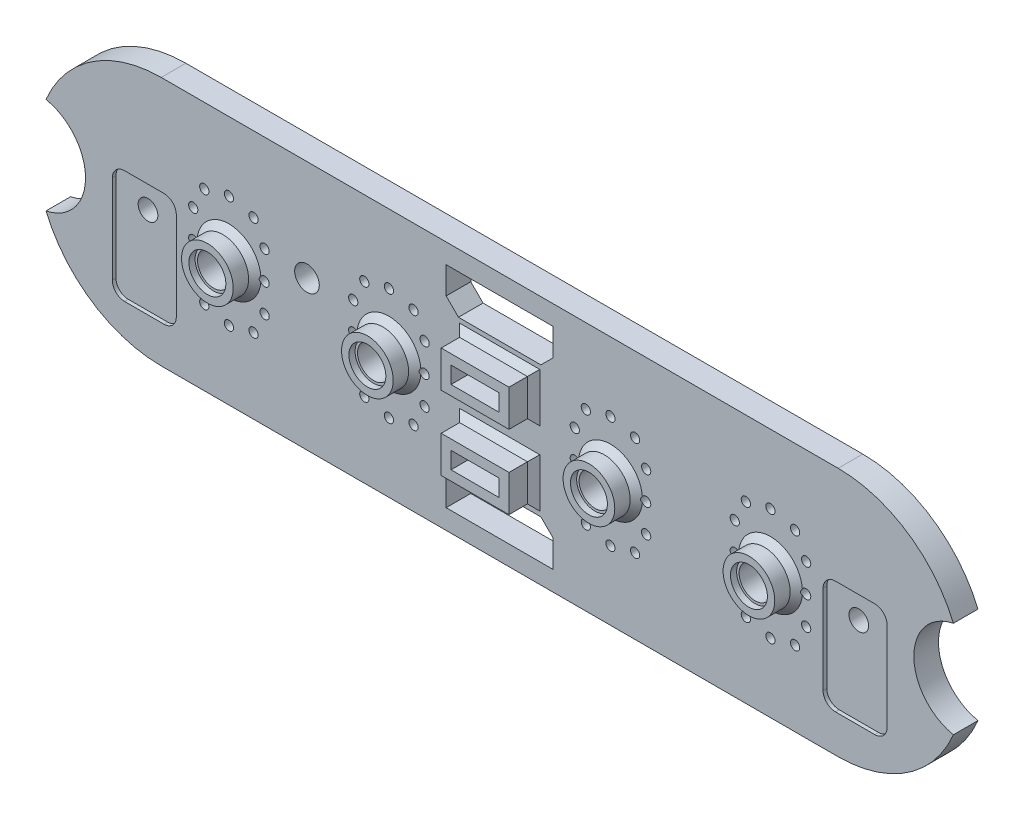
from build123d import *

# Parameters (mm, degrees)
BOSS_EXTRU_1_DEPTH      = 4
ENL_V_MAT_EXTRU_2_DEPTH = 79.090844534
ESQUISSE6_R             = 1.6
ENL_V_MAT_EXTRU_3_DEPTH = 77.571965361
ENL_V_MAT_EXTRU_4_DEPTH = 0.6
ESQUISSE2_R             = 0.75
ESQUISSE2_R_2           = 2.6
ESQUISSE2_W             = 7.82
ESQUISSE2_H             = 2.74
ENL_V_MAT_EXTRU_1_DEPTH = 77.571965361
BOSS_EXTRU_2_START      = 3.5
ESQUISSE3_R             = 4.2
ESQUISSE3_R_2           = 2.6
BOSS_EXTRU_2_DEPTH      = 3.5
ESQUISSE9_R             = 3
ENL_V_MAT_EXTRU_6_DEPTH = 1
ESQUISSE4_W             = 11.02
ESQUISSE4_H             = 5.94
ESQUISSE4_W_2           = 7.82
ESQUISSE4_H_2           = 2.74
BOSS_EXTRU_3_DEPTH      = 4
CHANFREIN1_SIZE         = 1
CONG_1_R                = 2
ESQUISSE8_R             = 2
ENL_V_MAT_EXTRU_5_DEPTH = 77.571965367


with BuildPart() as part:
    # Esquisse1 → Boss.-Extru.1 (new body)
    with BuildSketch(Plane.XY):
        with BuildLine():
            Line((-55, 20.3), (55, 20.3))
            ThreePointArc((55, 20.3), (75.3, 0), (55, -20.3))
            Line((55, -20.3), (-55, -20.3))
            ThreePointArc((-55, -20.3), (-75.3, 0), (-55, 20.3))
        make_face()
    extrude(amount=BOSS_EXTRU_1_DEPTH)

    # Esquisse5 → Enlèv. mat.-Extru.2 (cut, through all)
    with BuildSketch(Plane.XY.offset(4)):
        with BuildLine():
            ThreePointArc((-73.72364532, 7.84315663), (-67.3, 0), (-73.72364532, -7.84315663))
            ThreePointArc((-73.72364532, -7.84315663), (-75.3, 0), (-73.72364532, 7.84315663))
        make_face()
        with BuildLine():
            ThreePointArc((73.72364532, 7.84315663), (67.3, 0), (73.72364532, -7.84315663))
            ThreePointArc((73.72364532, -7.84315663), (75.3, 0), (73.72364532, 7.84315663))
        make_face()
    extrude(amount=-ENL_V_MAT_EXTRU_2_DEPTH, mode=Mode.SUBTRACT)

    # Esquisse6 → Enlèv. mat.-Extru.3 (cut, through all)
    with BuildSketch(Plane.XY.offset(4)):
        with Locations((-57.75, 0)):
            Circle(ESQUISSE6_R)
        with Locations((57.75, 0)):
            Circle(ESQUISSE6_R)
    extrude(amount=-ENL_V_MAT_EXTRU_3_DEPTH, mode=Mode.SUBTRACT)

    # Esquisse7 → Enlèv. mat.-Extru.4 (cut)
    with BuildSketch(Plane.XY.offset(4)):
        with BuildLine():
            Line((-60.95, 4.2), (-54.55, 4.2))
            ThreePointArc((-54.55, 4.2), (-53.135786438, 3.614213562), (-52.55, 2.2))
            Line((-52.55, 2.2), (-52.55, -12.2))
            ThreePointArc((-52.55, -12.2), (-53.135786438, -13.614213562), (-54.55, -14.2))
            Line((-54.55, -14.2), (-60.95, -14.2))
            ThreePointArc((-60.95, -14.2), (-62.364213562, -13.614213562), (-62.95, -12.2))
            Line((-62.95, -12.2), (-62.95, 2.2))
            ThreePointArc((-62.95, 2.2), (-62.364213562, 3.614213562), (-60.95, 4.2))
        make_face()
        with BuildLine():
            Line((60.95, 4.2), (54.55, 4.2))
            ThreePointArc((54.55, 4.2), (53.135786438, 3.614213562), (52.55, 2.2))
            Line((52.55, 2.2), (52.55, -12.2))
            ThreePointArc((52.55, -12.2), (53.135786438, -13.614213562), (54.55, -14.2))
            Line((54.55, -14.2), (60.95, -14.2))
            ThreePointArc((60.95, -14.2), (62.364213562, -13.614213562), (62.95, -12.2))
            Line((62.95, -12.2), (62.95, 2.2))
            ThreePointArc((62.95, 2.2), (62.364213562, 3.614213562), (60.95, 4.2))
        make_face()
    extrude(amount=-ENL_V_MAT_EXTRU_4_DEPTH, mode=Mode.SUBTRACT)

    # Esquisse2 → Enlèv. mat.-Extru.1 (cut, through all)
    with BuildSketch(Plane.XY.offset(4)):
        with Locations((-18, 9.1)):
            Circle(ESQUISSE2_R)
        with Locations((-13.999067147, 8.095272466)):
            Circle(ESQUISSE2_R)
        with Locations((-12.200668416, 4.596493574)):
            Circle(ESQUISSE2_R)
        with Locations((-12.2, 0)):
            Circle(ESQUISSE2_R)
        with Locations((-12.200668416, -4.596493574)):
            Circle(ESQUISSE2_R)
        with Locations((-13.999067147, -8.095272466)):
            Circle(ESQUISSE2_R)
        with Locations((-18, -9.1)):
            Circle(ESQUISSE2_R)
        with Locations((-22.000932853, -8.095272466)):
            Circle(ESQUISSE2_R)
        with Locations((-23.799331584, -4.596493574)):
            Circle(ESQUISSE2_R)
        with Locations((-23.8, 0)):
            Circle(ESQUISSE2_R)
        with Locations((-23.799331584, 4.596493574)):
            Circle(ESQUISSE2_R)
        with Locations((-22.000932853, 8.095272466)):
            Circle(ESQUISSE2_R)
        with Locations((-18, 0)):
            Circle(ESQUISSE2_R_2)
        with Locations((-48.000932853, 8.095272466)):
            Circle(ESQUISSE2_R)
        with Locations((-49.799331584, 4.596493574)):
            Circle(ESQUISSE2_R)
        with Locations((-49.8, 0)):
            Circle(ESQUISSE2_R)
        with Locations((-49.799331584, -4.596493574)):
            Circle(ESQUISSE2_R)
        with Locations((-44, 0)):
            Circle(ESQUISSE2_R_2)
        with Locations((-48.000932853, -8.095272466)):
            Circle(ESQUISSE2_R)
        with Locations((-44, -9.1)):
            Circle(ESQUISSE2_R)
        with Locations((-39.999067147, -8.095272466)):
            Circle(ESQUISSE2_R)
        with Locations((-38.200668416, -4.596493574)):
            Circle(ESQUISSE2_R)
        with Locations((-38.2, 0)):
            Circle(ESQUISSE2_R)
        with Locations((-38.200668416, 4.596493574)):
            Circle(ESQUISSE2_R)
        with Locations((-39.999067147, 8.095272466)):
            Circle(ESQUISSE2_R)
        with Locations((-44, 9.1)):
            Circle(ESQUISSE2_R)
        with Locations(Location((44, 9.1, 0), (0, 0, 180))):
            Circle(ESQUISSE2_R)
        with Locations(Location((39.999067147, 8.095272466, 0), (0, 0, 180))):
            Circle(ESQUISSE2_R)
        with Locations(Location((38.200668416, 4.596493574, 0), (0, 0, 180))):
            Circle(ESQUISSE2_R)
        with Locations(Location((38.2, 0, 0), (0, 0, 180))):
            Circle(ESQUISSE2_R)
        with Locations(Location((38.200668416, -4.596493574, 0), (0, 0, 180))):
            Circle(ESQUISSE2_R)
        with Locations(Location((39.999067147, -8.095272466, 0), (0, 0, 180))):
            Circle(ESQUISSE2_R)
        with Locations(Location((44, -9.1, 0), (0, 0, 180))):
            Circle(ESQUISSE2_R)
        with Locations(Location((48.000932853, -8.095272466, 0), (0, 0, 180))):
            Circle(ESQUISSE2_R)
        with Locations(Location((44, 0, 0), (0, 0, 180))):
            Circle(ESQUISSE2_R_2)
        with Locations(Location((49.799331584, -4.596493574, 0), (0, 0, 180))):
            Circle(ESQUISSE2_R)
        with Locations(Location((49.8, 0, 0), (0, 0, 180))):
            Circle(ESQUISSE2_R)
        with Locations(Location((49.799331584, 4.596493574, 0), (0, 0, 180))):
            Circle(ESQUISSE2_R)
        with Locations(Location((48.000932853, 8.095272466, 0), (0, 0, 180))):
            Circle(ESQUISSE2_R)
        with Locations(Location((18, 9.1, 0), (0, 0, 180))):
            Circle(ESQUISSE2_R)
        with Locations(Location((13.999067147, 8.095272466, 0), (0, 0, 180))):
            Circle(ESQUISSE2_R)
        with Locations(Location((12.200668416, 4.596493574, 0), (0, 0, 180))):
            Circle(ESQUISSE2_R)
        with Locations(Location((12.2, 0, 0), (0, 0, 180))):
            Circle(ESQUISSE2_R)
        with Locations(Location((12.200668416, -4.596493574, 0), (0, 0, 180))):
            Circle(ESQUISSE2_R)
        with Locations(Location((13.999067147, -8.095272466, 0), (0, 0, 180))):
            Circle(ESQUISSE2_R)
        with Locations(Location((18, -9.1, 0), (0, 0, 180))):
            Circle(ESQUISSE2_R)
        with Locations(Location((22.000932853, -8.095272466, 0), (0, 0, 180))):
            Circle(ESQUISSE2_R)
        with Locations(Location((18, 0, 0), (0, 0, 180))):
            Circle(ESQUISSE2_R_2)
        with Locations(Location((23.799331584, -4.596493574, 0), (0, 0, 180))):
            Circle(ESQUISSE2_R)
        with Locations(Location((23.8, 0, 0), (0, 0, 180))):
            Circle(ESQUISSE2_R)
        with Locations(Location((23.799331584, 4.596493574, 0), (0, 0, 180))):
            Circle(ESQUISSE2_R)
        with Locations(Location((22.000932853, 8.095272466, 0), (0, 0, 180))):
            Circle(ESQUISSE2_R)
        with Locations((0, 6)):
            Rectangle(ESQUISSE2_W, ESQUISSE2_H)
        with Locations((0, -6)):
            Rectangle(ESQUISSE2_W, ESQUISSE2_H)
    extrude(amount=-ENL_V_MAT_EXTRU_1_DEPTH, mode=Mode.SUBTRACT)

    # Esquisse3 → Boss.-Extru.2 (add)
    # profile 1 of 4: a face of its own
    with BuildSketch(Plane.XY.offset(4).offset(BOSS_EXTRU_2_START)):
        with Locations((-44, 0)):
            Circle(ESQUISSE3_R)
        with Locations((-44, 0)):
            Circle(ESQUISSE3_R_2, mode=Mode.SUBTRACT)
    # profile 2 of 4: a face of its own
    with BuildSketch(Plane.XY.offset(4).offset(BOSS_EXTRU_2_START)):
        with Locations((-18, 0)):
            Circle(ESQUISSE3_R)
        with Locations((-18, 0)):
            Circle(ESQUISSE3_R_2, mode=Mode.SUBTRACT)
    # profile 3 of 4: a face of its own
    with BuildSketch(Plane.XY.offset(4).offset(BOSS_EXTRU_2_START)):
        with Locations((18, 0)):
            Circle(ESQUISSE3_R)
        with Locations((18, 0)):
            Circle(ESQUISSE3_R_2, mode=Mode.SUBTRACT)
    # profile 4 of 4: a face of its own
    with BuildSketch(Plane.XY.offset(4).offset(BOSS_EXTRU_2_START)):
        with Locations((44, 0)):
            Circle(ESQUISSE3_R)
        with Locations((44, 0)):
            Circle(ESQUISSE3_R_2, mode=Mode.SUBTRACT)
    extrude(amount=-BOSS_EXTRU_2_DEPTH)

    # Esquisse9 → Enlèv. mat.-Extru.6 (cut)
    with BuildSketch(Plane.XY.offset(7.5)):
        with Locations((-44, 0)):
            Circle(ESQUISSE9_R)
        with Locations((-18, 0)):
            Circle(ESQUISSE9_R)
        with Locations((18, 0)):
            Circle(ESQUISSE9_R)
        with Locations((44, 0)):
            Circle(ESQUISSE9_R)
    extrude(amount=-ENL_V_MAT_EXTRU_6_DEPTH, mode=Mode.SUBTRACT)

    # Esquisse4 → Boss.-Extru.3 (add)
    # profile 1 of 2: a face of its own
    with BuildSketch(Plane.XY.offset(4)):
        with Locations((0, -6)):
            Rectangle(ESQUISSE4_W, ESQUISSE4_H)
        with Locations((0, -6)):
            Rectangle(ESQUISSE4_W_2, ESQUISSE4_H_2, mode=Mode.SUBTRACT)
    # profile 2 of 2: a face of its own
    with BuildSketch(Plane.XY.offset(4)):
        with Locations((0, 6)):
            Rectangle(ESQUISSE4_W, ESQUISSE4_H)
        with Locations((0, 6)):
            Rectangle(ESQUISSE4_W_2, ESQUISSE4_H_2, mode=Mode.SUBTRACT)
    extrude(amount=BOSS_EXTRU_3_DEPTH)

    # Chanfrein1
    # the kernel refuses this chamfer: 1 mm, written as the material it adds along each edge
    with BuildSketch(Plane(origin=(-44, 0, 4), x_dir=(1, 0, 0), z_dir=(0, -1, 0))) as chanfrein1_piece_1_section:
        Polygon((4.2 + CHANFREIN1_SIZE, 0), (4.2, CHANFREIN1_SIZE), (4.2, 0), align=None)
    chanfrein1_piece_1 = revolve(axis=Axis((-44, 0, 4), (0, 0, 1)), mode=Mode.PRIVATE)
    chanfrein1_piece_1 = chanfrein1_piece_1 - Plane(origin=(-38.2, 0, 4.482316318), x_dir=(1, 0, 0), z_dir=(0, 0, 1)) * Cylinder(0.75, 21, mode=Mode.PRIVATE)
    chanfrein1_piece_1 = chanfrein1_piece_1 - Plane(origin=(-49.8, 0, 4.482316318), x_dir=(1, 0, 0), z_dir=(0, 0, 1)) * Cylinder(0.75, 21, mode=Mode.PRIVATE)
    add(chanfrein1_piece_1)
    with BuildSketch(Plane(origin=(-18, 0, 4), x_dir=(1, 0, 0), z_dir=(0, -1, 0))) as chanfrein1_piece_2_section:
        Polygon((4.2 + CHANFREIN1_SIZE, 0), (4.2, CHANFREIN1_SIZE), (4.2, 0), align=None)
    chanfrein1_piece_2 = revolve(axis=Axis((-18, 0, 4), (0, 0, 1)), mode=Mode.PRIVATE)
    chanfrein1_piece_2 = chanfrein1_piece_2 - Plane(origin=(-12.2, 0, 4.482316318), x_dir=(1, 0, 0), z_dir=(0, 0, 1)) * Cylinder(0.75, 21, mode=Mode.PRIVATE)
    chanfrein1_piece_2 = chanfrein1_piece_2 - Plane(origin=(-23.8, 0, 4.482316318), x_dir=(1, 0, 0), z_dir=(0, 0, 1)) * Cylinder(0.75, 21, mode=Mode.PRIVATE)
    add(chanfrein1_piece_2)
    with BuildSketch(Plane(origin=(18, 0, 4), x_dir=(1, 0, 0), z_dir=(0, -1, 0))) as chanfrein1_piece_3_section:
        Polygon((4.2 + CHANFREIN1_SIZE, 0), (4.2, CHANFREIN1_SIZE), (4.2, 0), align=None)
    chanfrein1_piece_3 = revolve(axis=Axis((18, 0, 4), (0, 0, 1)), mode=Mode.PRIVATE)
    chanfrein1_piece_3 = chanfrein1_piece_3 - Plane(origin=(23.8, 0, 4.482316319), x_dir=(-1, 0, 0), z_dir=(0, 0, 1)) * Cylinder(0.75, 21, mode=Mode.PRIVATE)
    chanfrein1_piece_3 = chanfrein1_piece_3 - Plane(origin=(12.2, 0, 4.482316319), x_dir=(-1, 0, 0), z_dir=(0, 0, 1)) * Cylinder(0.75, 21, mode=Mode.PRIVATE)
    add(chanfrein1_piece_3)
    with BuildSketch(Plane(origin=(44, 0, 4), x_dir=(1, 0, 0), z_dir=(0, -1, 0))) as chanfrein1_piece_4_section:
        Polygon((4.2 + CHANFREIN1_SIZE, 0), (4.2, CHANFREIN1_SIZE), (4.2, 0), align=None)
    chanfrein1_piece_4 = revolve(axis=Axis((44, 0, 4), (0, 0, 1)), mode=Mode.PRIVATE)
    chanfrein1_piece_4 = chanfrein1_piece_4 - Plane(origin=(49.8, 0, 4.482316319), x_dir=(-1, 0, 0), z_dir=(0, 0, 1)) * Cylinder(0.75, 21, mode=Mode.PRIVATE)
    chanfrein1_piece_4 = chanfrein1_piece_4 - Plane(origin=(38.2, 0, 4.482316319), x_dir=(-1, 0, 0), z_dir=(0, 0, 1)) * Cylinder(0.75, 21, mode=Mode.PRIVATE)
    add(chanfrein1_piece_4)
    with BuildSketch(Plane(origin=(-5.51, -3.03, 4), x_dir=(-0.9996219169112968, 0, -0.027495876610586487), z_dir=(0, -1, 0)), Plane(origin=(5.51, -8.97, 4), x_dir=(0.9996219169112968, 0, -0.027495876610586487), z_dir=(0, 1, 0)), Plane(origin=(-5.51, 8.97, 4), x_dir=(-0.9996219169112968, 0, -0.027495876610586487), z_dir=(0, -1, 0)), Plane(origin=(5.51, 3.03, 4), x_dir=(0.9996219169112968, 0, -0.027495876610586487), z_dir=(0, 1, 0))) as chanfrein1_piece_5:
        Polygon((CHANFREIN1_SIZE * 0.999621916911, -CHANFREIN1_SIZE * 0.0274958766106), (-CHANFREIN1_SIZE * 0.0274958766106, -CHANFREIN1_SIZE * 0.999621916911), (0, 0), align=None)
    extrude(amount=5.94)
    with BuildSketch(Plane(origin=(5.51, -3.03, 4), x_dir=(0, 0.9996219169112968, -0.027495876610586487), z_dir=(-1, 0, 0)), Plane(origin=(-5.51, -8.97, 4), x_dir=(0, -0.9996219169112968, -0.02749587661058651), z_dir=(1, 0, 0)), Plane(origin=(5.51, 8.97, 4), x_dir=(0, 0.9996219169112968, -0.02749587661058651), z_dir=(-1, 0, 0)), Plane(origin=(-5.51, 3.03, 4), x_dir=(0, -0.9996219169112968, -0.027495876610586487), z_dir=(1, 0, 0))) as chanfrein1_piece_6:
        Polygon((CHANFREIN1_SIZE * 0.999621916911, -CHANFREIN1_SIZE * 0.0274958766106), (-CHANFREIN1_SIZE * 0.0274958766106, -CHANFREIN1_SIZE * 0.999621916911), (0, 0), align=None)
    extrude(amount=11.02)
    with BuildSketch(Plane(origin=(-5.51, -0.458317012, 4), x_dir=(-0.9996219169112968, 0, -0.027495876610586487), z_dir=(0, -1, 0))) as chanfrein1_piece_7a_section:
        Polygon((CHANFREIN1_SIZE * 0.999621916911, -CHANFREIN1_SIZE * 0.0274958766106), (-CHANFREIN1_SIZE * 0.0274958766106, -CHANFREIN1_SIZE * 0.999621916911), (0, 0), align=None)
    chanfrein1_piece_7a = extrude(amount=8.511682988, mode=Mode.PRIVATE)
    chanfrein1_piece_7a = split(chanfrein1_piece_7a, bisect_by=Plane(origin=(-5.839793627, -3.03, 4.329793627), z_dir=(0, 1, 0)), keep=Keep.TOP, mode=Mode.PRIVATE)
    with BuildSketch(Plane(origin=(5.51, -3.03, 4), x_dir=(0, 0.9996219169112968, -0.027495876610586487), z_dir=(-1, 0, 0))) as chanfrein1_piece_7b_section:
        Polygon((CHANFREIN1_SIZE * 0.999621916911, -CHANFREIN1_SIZE * 0.0274958766106), (-CHANFREIN1_SIZE * 0.0274958766106, -CHANFREIN1_SIZE * 0.999621916911), (0, 0), align=None)
    chanfrein1_piece_7b = extrude(amount=13.591682988, mode=Mode.PRIVATE)
    chanfrein1_piece_7b = split(chanfrein1_piece_7b, bisect_by=Plane(origin=(-5.51, -2.700206373, 4.329793627), z_dir=(-1, 0, 0)), keep=Keep.TOP, mode=Mode.PRIVATE)
    chanfrein1_piece_7 = chanfrein1_piece_7a & chanfrein1_piece_7b
    add(chanfrein1_piece_7)
    with BuildSketch(Plane(origin=(-8.081682988, -8.97, 4), x_dir=(0, -0.9996219169112968, -0.02749587661058651), z_dir=(1, 0, 0))) as chanfrein1_piece_8a_section:
        Polygon((CHANFREIN1_SIZE * 0.999621916911, -CHANFREIN1_SIZE * 0.0274958766106), (-CHANFREIN1_SIZE * 0.0274958766106, -CHANFREIN1_SIZE * 0.999621916911), (0, 0), align=None)
    chanfrein1_piece_8a = extrude(amount=13.591682988, mode=Mode.PRIVATE)
    chanfrein1_piece_8a = split(chanfrein1_piece_8a, bisect_by=Plane(origin=(-5.51, -9.299793627, 4.329793627), z_dir=(-1, 0, 0)), keep=Keep.TOP, mode=Mode.PRIVATE)
    with BuildSketch(Plane(origin=(-5.51, -3.03, 4), x_dir=(-0.9996219169112968, 0, -0.027495876610586487), z_dir=(0, -1, 0))) as chanfrein1_piece_8b_section:
        Polygon((CHANFREIN1_SIZE * 0.999621916911, -CHANFREIN1_SIZE * 0.0274958766106), (-CHANFREIN1_SIZE * 0.0274958766106, -CHANFREIN1_SIZE * 0.999621916911), (0, 0), align=None)
    chanfrein1_piece_8b = extrude(amount=8.511682988, mode=Mode.PRIVATE)
    chanfrein1_piece_8b = split(chanfrein1_piece_8b, bisect_by=Plane(origin=(-5.839793627, -8.97, 4.329793627), z_dir=(0, -1, 0)), keep=Keep.TOP, mode=Mode.PRIVATE)
    chanfrein1_piece_8 = chanfrein1_piece_8a & chanfrein1_piece_8b
    add(chanfrein1_piece_8)
    with BuildSketch(Plane(origin=(8.081682988, -3.03, 4), x_dir=(0, 0.9996219169112968, -0.027495876610586487), z_dir=(-1, 0, 0))) as chanfrein1_piece_9a_section:
        Polygon((CHANFREIN1_SIZE * 0.999621916911, -CHANFREIN1_SIZE * 0.0274958766106), (-CHANFREIN1_SIZE * 0.0274958766106, -CHANFREIN1_SIZE * 0.999621916911), (0, 0), align=None)
    chanfrein1_piece_9a = extrude(amount=13.591682988, mode=Mode.PRIVATE)
    chanfrein1_piece_9a = split(chanfrein1_piece_9a, bisect_by=Plane(origin=(5.51, -2.700206373, 4.329793627), z_dir=(1, 0, 0)), keep=Keep.TOP, mode=Mode.PRIVATE)
    with BuildSketch(Plane(origin=(5.51, -8.97, 4), x_dir=(0.9996219169112968, 0, -0.027495876610586487), z_dir=(0, 1, 0))) as chanfrein1_piece_9b_section:
        Polygon((CHANFREIN1_SIZE * 0.999621916911, -CHANFREIN1_SIZE * 0.0274958766106), (-CHANFREIN1_SIZE * 0.0274958766106, -CHANFREIN1_SIZE * 0.999621916911), (0, 0), align=None)
    chanfrein1_piece_9b = extrude(amount=8.511682988, mode=Mode.PRIVATE)
    chanfrein1_piece_9b = split(chanfrein1_piece_9b, bisect_by=Plane(origin=(5.839793627, -3.03, 4.329793627), z_dir=(0, 1, 0)), keep=Keep.TOP, mode=Mode.PRIVATE)
    chanfrein1_piece_9 = chanfrein1_piece_9a & chanfrein1_piece_9b
    add(chanfrein1_piece_9)
    with BuildSketch(Plane(origin=(-5.51, -8.97, 4), x_dir=(0, -0.9996219169112968, -0.02749587661058651), z_dir=(1, 0, 0))) as chanfrein1_piece_10a_section:
        Polygon((CHANFREIN1_SIZE * 0.999621916911, -CHANFREIN1_SIZE * 0.0274958766106), (-CHANFREIN1_SIZE * 0.0274958766106, -CHANFREIN1_SIZE * 0.999621916911), (0, 0), align=None)
    chanfrein1_piece_10a = extrude(amount=13.591682988, mode=Mode.PRIVATE)
    chanfrein1_piece_10a = split(chanfrein1_piece_10a, bisect_by=Plane(origin=(5.51, -9.299793627, 4.329793627), z_dir=(1, 0, 0)), keep=Keep.TOP, mode=Mode.PRIVATE)
    with BuildSketch(Plane(origin=(5.51, -11.541682988, 4), x_dir=(0.9996219169112968, 0, -0.027495876610586487), z_dir=(0, 1, 0))) as chanfrein1_piece_10b_section:
        Polygon((CHANFREIN1_SIZE * 0.999621916911, -CHANFREIN1_SIZE * 0.0274958766106), (-CHANFREIN1_SIZE * 0.0274958766106, -CHANFREIN1_SIZE * 0.999621916911), (0, 0), align=None)
    chanfrein1_piece_10b = extrude(amount=8.511682988, mode=Mode.PRIVATE)
    chanfrein1_piece_10b = split(chanfrein1_piece_10b, bisect_by=Plane(origin=(5.839793627, -8.97, 4.329793627), z_dir=(0, -1, 0)), keep=Keep.TOP, mode=Mode.PRIVATE)
    chanfrein1_piece_10 = chanfrein1_piece_10a & chanfrein1_piece_10b
    add(chanfrein1_piece_10)
    with BuildSketch(Plane(origin=(-5.51, 11.541682988, 4), x_dir=(-0.9996219169112968, 0, -0.027495876610586487), z_dir=(0, -1, 0))) as chanfrein1_piece_11a_section:
        Polygon((CHANFREIN1_SIZE * 0.999621916911, -CHANFREIN1_SIZE * 0.0274958766106), (-CHANFREIN1_SIZE * 0.0274958766106, -CHANFREIN1_SIZE * 0.999621916911), (0, 0), align=None)
    chanfrein1_piece_11a = extrude(amount=8.511682988, mode=Mode.PRIVATE)
    chanfrein1_piece_11a = split(chanfrein1_piece_11a, bisect_by=Plane(origin=(-5.839793627, 8.97, 4.329793627), z_dir=(0, 1, 0)), keep=Keep.TOP, mode=Mode.PRIVATE)
    with BuildSketch(Plane(origin=(5.51, 8.97, 4), x_dir=(0, 0.9996219169112968, -0.02749587661058651), z_dir=(-1, 0, 0))) as chanfrein1_piece_11b_section:
        Polygon((CHANFREIN1_SIZE * 0.999621916911, -CHANFREIN1_SIZE * 0.0274958766106), (-CHANFREIN1_SIZE * 0.0274958766106, -CHANFREIN1_SIZE * 0.999621916911), (0, 0), align=None)
    chanfrein1_piece_11b = extrude(amount=13.591682988, mode=Mode.PRIVATE)
    chanfrein1_piece_11b = split(chanfrein1_piece_11b, bisect_by=Plane(origin=(-5.51, 9.299793627, 4.329793627), z_dir=(-1, 0, 0)), keep=Keep.TOP, mode=Mode.PRIVATE)
    chanfrein1_piece_11 = chanfrein1_piece_11a & chanfrein1_piece_11b
    add(chanfrein1_piece_11)
    with BuildSketch(Plane(origin=(-8.081682988, 3.03, 4), x_dir=(0, -0.9996219169112968, -0.027495876610586487), z_dir=(1, 0, 0))) as chanfrein1_piece_12a_section:
        Polygon((CHANFREIN1_SIZE * 0.999621916911, -CHANFREIN1_SIZE * 0.0274958766106), (-CHANFREIN1_SIZE * 0.0274958766106, -CHANFREIN1_SIZE * 0.999621916911), (0, 0), align=None)
    chanfrein1_piece_12a = extrude(amount=13.591682988, mode=Mode.PRIVATE)
    chanfrein1_piece_12a = split(chanfrein1_piece_12a, bisect_by=Plane(origin=(-5.51, 2.700206373, 4.329793627), z_dir=(-1, 0, 0)), keep=Keep.TOP, mode=Mode.PRIVATE)
    with BuildSketch(Plane(origin=(-5.51, 8.97, 4), x_dir=(-0.9996219169112968, 0, -0.027495876610586487), z_dir=(0, -1, 0))) as chanfrein1_piece_12b_section:
        Polygon((CHANFREIN1_SIZE * 0.999621916911, -CHANFREIN1_SIZE * 0.0274958766106), (-CHANFREIN1_SIZE * 0.0274958766106, -CHANFREIN1_SIZE * 0.999621916911), (0, 0), align=None)
    chanfrein1_piece_12b = extrude(amount=8.511682988, mode=Mode.PRIVATE)
    chanfrein1_piece_12b = split(chanfrein1_piece_12b, bisect_by=Plane(origin=(-5.839793627, 3.03, 4.329793627), z_dir=(0, -1, 0)), keep=Keep.TOP, mode=Mode.PRIVATE)
    chanfrein1_piece_12 = chanfrein1_piece_12a & chanfrein1_piece_12b
    add(chanfrein1_piece_12)
    with BuildSketch(Plane(origin=(8.081682988, 8.97, 4), x_dir=(0, 0.9996219169112968, -0.02749587661058651), z_dir=(-1, 0, 0))) as chanfrein1_piece_13a_section:
        Polygon((CHANFREIN1_SIZE * 0.999621916911, -CHANFREIN1_SIZE * 0.0274958766106), (-CHANFREIN1_SIZE * 0.0274958766106, -CHANFREIN1_SIZE * 0.999621916911), (0, 0), align=None)
    chanfrein1_piece_13a = extrude(amount=13.591682988, mode=Mode.PRIVATE)
    chanfrein1_piece_13a = split(chanfrein1_piece_13a, bisect_by=Plane(origin=(5.51, 9.299793627, 4.329793627), z_dir=(1, 0, 0)), keep=Keep.TOP, mode=Mode.PRIVATE)
    with BuildSketch(Plane(origin=(5.51, 3.03, 4), x_dir=(0.9996219169112968, 0, -0.027495876610586487), z_dir=(0, 1, 0))) as chanfrein1_piece_13b_section:
        Polygon((CHANFREIN1_SIZE * 0.999621916911, -CHANFREIN1_SIZE * 0.0274958766106), (-CHANFREIN1_SIZE * 0.0274958766106, -CHANFREIN1_SIZE * 0.999621916911), (0, 0), align=None)
    chanfrein1_piece_13b = extrude(amount=8.511682988, mode=Mode.PRIVATE)
    chanfrein1_piece_13b = split(chanfrein1_piece_13b, bisect_by=Plane(origin=(5.839793627, 8.97, 4.329793627), z_dir=(0, 1, 0)), keep=Keep.TOP, mode=Mode.PRIVATE)
    chanfrein1_piece_13 = chanfrein1_piece_13a & chanfrein1_piece_13b
    add(chanfrein1_piece_13)
    with BuildSketch(Plane(origin=(-5.51, 3.03, 4), x_dir=(0, -0.9996219169112968, -0.027495876610586487), z_dir=(1, 0, 0))) as chanfrein1_piece_14a_section:
        Polygon((CHANFREIN1_SIZE * 0.999621916911, -CHANFREIN1_SIZE * 0.0274958766106), (-CHANFREIN1_SIZE * 0.0274958766106, -CHANFREIN1_SIZE * 0.999621916911), (0, 0), align=None)
    chanfrein1_piece_14a = extrude(amount=13.591682988, mode=Mode.PRIVATE)
    chanfrein1_piece_14a = split(chanfrein1_piece_14a, bisect_by=Plane(origin=(5.51, 2.700206373, 4.329793627), z_dir=(1, 0, 0)), keep=Keep.TOP, mode=Mode.PRIVATE)
    with BuildSketch(Plane(origin=(5.51, 0.458317012, 4), x_dir=(0.9996219169112968, 0, -0.027495876610586487), z_dir=(0, 1, 0))) as chanfrein1_piece_14b_section:
        Polygon((CHANFREIN1_SIZE * 0.999621916911, -CHANFREIN1_SIZE * 0.0274958766106), (-CHANFREIN1_SIZE * 0.0274958766106, -CHANFREIN1_SIZE * 0.999621916911), (0, 0), align=None)
    chanfrein1_piece_14b = extrude(amount=8.511682988, mode=Mode.PRIVATE)
    chanfrein1_piece_14b = split(chanfrein1_piece_14b, bisect_by=Plane(origin=(5.839793627, 3.03, 4.329793627), z_dir=(0, -1, 0)), keep=Keep.TOP, mode=Mode.PRIVATE)
    chanfrein1_piece_14 = chanfrein1_piece_14a & chanfrein1_piece_14b
    add(chanfrein1_piece_14)

    # Congé1
    cong_1_edges = [part.edges().sort_by_distance(p)[0] for p in [
        (-46.6, 0, 0),
        (-20.6, 0, 0),
        (46.6, 0, 0),
        (20.6, 0, 0),
    ]]
    fillet(cong_1_edges, radius=CONG_1_R)

    # Esquisse8 → Enlèv. mat.-Extru.5 (cut, through all)
    with BuildSketch(Plane.XY.offset(4)):
        with Locations((-31.315113157, 3.9002338)):
            Circle(ESQUISSE8_R)
        Polygon((-8.7, 17.1), (8.7, 17.1), (8.7, 12.7), (6.7, 10.7), (-6.7, 10.7), (-8.7, 12.7), align=None)
        Polygon((-8.7, -17.1), (-8.7, -12.7), (-6.7, -10.7), (6.7, -10.7), (8.7, -12.7), (8.7, -17.1), align=None)
    extrude(amount=-ENL_V_MAT_EXTRU_5_DEPTH, mode=Mode.SUBTRACT)


solid = part.part
